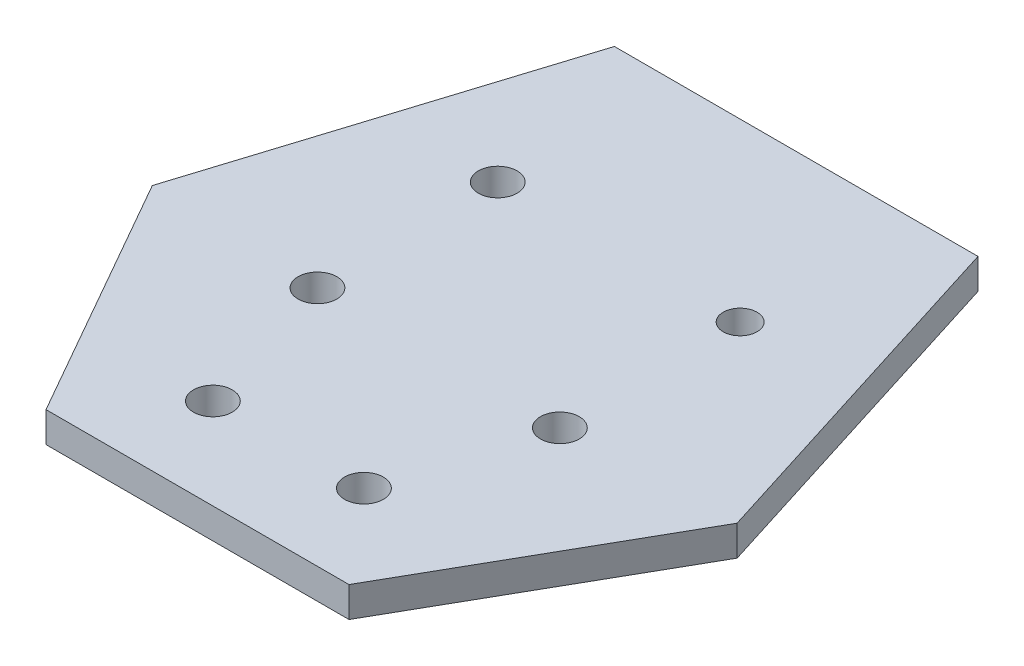
from build123d import *

# Parameters (mm, degrees)
BOSS_EXTRUDE1_DEPTH = 1.5875
SKETCH2_R           = 1.778
SKETCH2_R_2         = 2.032
CUT_EXTRUDE1_DEPTH  = 81.0912825


with BuildPart() as part:
    # Sketch1 → Boss-Extrude1 (new, symmetric)
    with BuildSketch(Plane(origin=(0, 0, 0), x_dir=(1, 0, 0), z_dir=(0, 1, 0))):
        Polygon((0, 0), (-11.58875, -36.83), (3.175, -62.734050012), (34.925, -62.734050012), (49.68875, -36.83), (38.1, 0), align=None)
    extrude(amount=BOSS_EXTRUDE1_DEPTH, both=True)

    # Sketch2 → Cut-Extrude1 (cut, through all)
    with BuildSketch(Plane(origin=(0, 1.5875, 0), x_dir=(1, 0, 0), z_dir=(0, 1, 0))):
        with Locations((31.59125, -18.415)):
            Circle(SKETCH2_R)
        with Locations((6.19125, -18.415)):
            Circle(SKETCH2_R_2)
        with Locations((6.35, -37.465)):
            Circle(SKETCH2_R_2)
        with Locations((31.75, -37.465)):
            Circle(SKETCH2_R_2)
        with Locations((11.135669629, -53.209050012)):
            Circle(SKETCH2_R_2)
        with Locations((26.964330371, -53.209050012)):
            Circle(SKETCH2_R_2)
    extrude(amount=-CUT_EXTRUDE1_DEPTH, mode=Mode.SUBTRACT)


solid = part.part
